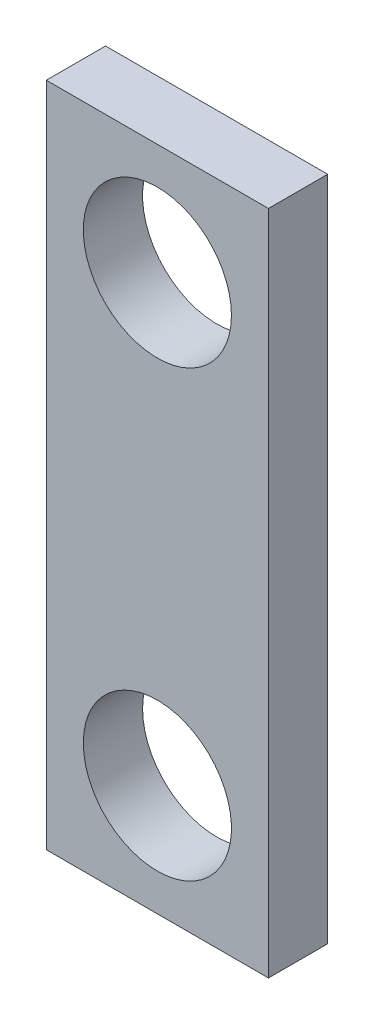
from build123d import *

# Parameters (mm, degrees)
SKETCH1_W           = 19.05
SKETCH1_H           = 57.15
SKETCH1_R           = 6.35
BOSS_EXTRUDE2_DEPTH = 5.08


with BuildPart() as part:
    # Sketch1 → Boss-Extrude2 (new body)
    with BuildSketch(Plane.XY):
        with Locations((0, -200.025)):
            Rectangle(SKETCH1_W, SKETCH1_H)
        with Locations((0, -180.975)):
            Circle(SKETCH1_R, mode=Mode.SUBTRACT)
        with Locations((0, -219.075)):
            Circle(SKETCH1_R, mode=Mode.SUBTRACT)
    extrude(amount=BOSS_EXTRUDE2_DEPTH)


solid = part.part
